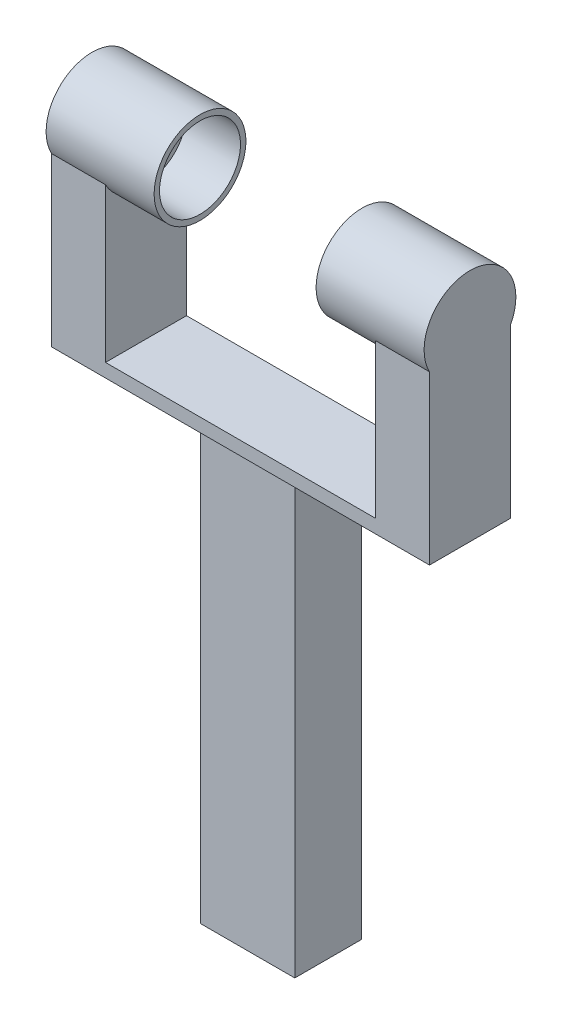
from build123d import *

# Parameters (mm, degrees)
SKETCH1_W                 = 140
SKETCH1_H                 = 30
BOSS_EXTRUDE1_DEPTH       = 5
EXTRUDE_THIN1_START       = -5
EXTRUDE_THIN1_OUTLINE_W   = 20
EXTRUDE_THIN1_OUTLINE_H   = 30
EXTRUDE_THIN1_OUTLINE_W_2 = 16
EXTRUDE_THIN1_OUTLINE_H_2 = 26
EXTRUDE_THIN1_DEPTH       = 85
FILLET1_SIZE              = 15
SKETCH3_R                 = 17
SKETCH3_R_2               = 15
EXTRUDE_THIN2_DEPTH       = 40
SKETCH4_W                 = 35
SKETCH4_H                 = 24.79
BOSS_EXTRUDE2_DEPTH       = 160


with BuildPart() as part:
    # Sketch1 → Boss-Extrude1 (new body)
    with BuildSketch(Plane(origin=(0, 0, 0), x_dir=(1, 0, 0), z_dir=(0, 1, 0))):
        Rectangle(SKETCH1_W, SKETCH1_H)
    extrude(amount=-BOSS_EXTRUDE1_DEPTH)

    # Extrude-Thin1: read off the stored shape, not the designer's step
    # Extrude-Thin1 outline → Extrude-Thin1 (add)
    # profile 1 of 2: a face of its own
    with BuildSketch(Plane(origin=(0, 0, 0), x_dir=(1, 0, 0), z_dir=(0, 1, 0)).offset(EXTRUDE_THIN1_START)):
        with Locations((60, 0)):
            Rectangle(EXTRUDE_THIN1_OUTLINE_W, EXTRUDE_THIN1_OUTLINE_H)
        with Locations((60, 0)):
            Rectangle(EXTRUDE_THIN1_OUTLINE_W_2, EXTRUDE_THIN1_OUTLINE_H_2, mode=Mode.SUBTRACT)
    # profile 2 of 2: a face of its own
    with BuildSketch(Plane(origin=(0, 0, 0), x_dir=(1, 0, 0), z_dir=(0, 1, 0)).offset(EXTRUDE_THIN1_START)):
        with Locations((-60, 0)):
            Rectangle(EXTRUDE_THIN1_OUTLINE_W, EXTRUDE_THIN1_OUTLINE_H)
        with Locations((-60, 0)):
            Rectangle(EXTRUDE_THIN1_OUTLINE_W_2, EXTRUDE_THIN1_OUTLINE_H_2, mode=Mode.SUBTRACT)
    extrude(amount=EXTRUDE_THIN1_DEPTH)

    # Fillet1
    # a fillet whose section is not a circle: 15 mm, written as the material it takes off along each edge
    with BuildSketch(Plane(origin=(-107.5, 80, 15), x_dir=(0, -1, 0), z_dir=(1, 0, 0)), Plane(origin=(-12.5, 80, -15), x_dir=(0, -1, 0), z_dir=(-1, 0, 0)), Plane(origin=(107.5, 80, -15), x_dir=(0, -1, 0), z_dir=(-1, 0, 0)), Plane(origin=(12.5, 80, 15), x_dir=(0, -1, 0), z_dir=(1, 0, 0))) as fillet1_piece_1:
        with BuildLine():
            Bezier((FILLET1_SIZE, 0), (0, 0), (0, FILLET1_SIZE), weights=[1, 1.060660172, 1])
            Line((0, FILLET1_SIZE), (0, 0))
            Line((0, 0), (FILLET1_SIZE, 0))
        make_face()
    extrude(amount=95, mode=Mode.SUBTRACT)

    # Sketch3 → Extrude-Thin2 (add)
    with BuildSketch(Plane.ZY.offset(70)):
        with Locations((0, 65)):
            Circle(SKETCH3_R)
        with Locations((0, 65)):
            Circle(SKETCH3_R_2, mode=Mode.SUBTRACT)
    extrude_thin2 = extrude(amount=-EXTRUDE_THIN2_DEPTH)

    # Mirror1: Extrude-Thin2 across plane
    add(extrude_thin2.mirror(Plane(origin=(0, 0, 0), x_dir=(0, 0, 1), z_dir=(1, 0, 0))))

    # Sketch4 → Boss-Extrude2 (add)
    with BuildSketch(Plane.XZ.offset(5)):
        Rectangle(SKETCH4_W, SKETCH4_H)
    extrude(amount=BOSS_EXTRUDE2_DEPTH)


solid = part.part
